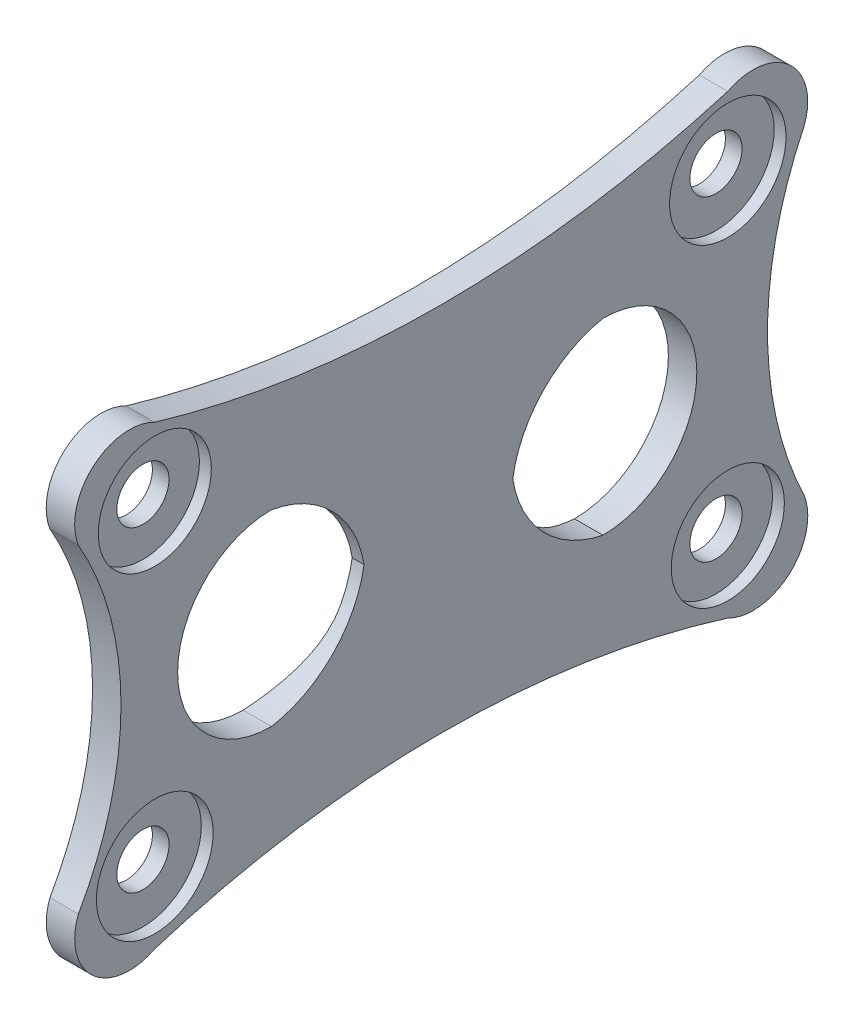
from build123d import *

# Parameters (mm, degrees)
SKETCH_1_W          = 87
SKETCH_1_H          = 63
SKETCH_1_W_2        = 83
SKETCH_1_H_2        = 59
EXTRUDE_1_DEPTH     = 5
SKETCH_2_W          = 87
SKETCH_2_H          = 63
EXTRUDE_2_DEPTH     = 3
SKETCH_3_W          = 2.764626384
SKETCH_3_H          = 4.6515936
CUT_EXTRUDE_1_DEPTH = 2
FILLET_1_R          = 2
SKETCH_5_R          = 2.75
CUT_EXTRUDE_2_DEPTH = 10
SKETCH_6_OUTSIDE_W  = 110.542
SKETCH_6_OUTSIDE_H  = 86.542
CUT_EXTRUDE_3_DEPTH = 10
SKETCH_7_W          = 10.763963746
SKETCH_7_H          = 73.165580881
CUT_EXTRUDE_4_DEPTH = 125
SKETCH_8_R          = 5.963187944
SKETCH_8_R_2        = 6.141451549
SKETCH_8_R_3        = 6.157472201
SKETCH_8_R_4        = 5.967235868
CUT_EXTRUDE_5_DEPTH = 1.25
SKETCH_9_W          = 15.387789175
SKETCH_9_H          = 31.944271198
EXTRUDE_4_DEPTH     = 1.25
FILLET_2_R          = 12


with BuildPart() as part:
    # 草图1 → 凸台-拉伸1 (new body)
    with BuildSketch(Plane(origin=(0, 0, 0), x_dir=(0, 0, -1), z_dir=(1, 0, 0))):
        with Locations((3.90387463, 17.013155975)):
            Rectangle(SKETCH_1_W, SKETCH_1_H)
        with Locations((3.90387463, 17.013155975)):
            Rectangle(SKETCH_1_W_2, SKETCH_1_H_2, mode=Mode.SUBTRACT)
    extrude(amount=EXTRUDE_1_DEPTH)

    # 草图2 → 凸台-拉伸2 (add)
    with BuildSketch(Plane(origin=(5, 0, 0), x_dir=(0, 0, -1), z_dir=(1, 0, 0))):
        with Locations((3.90387463, 17.013155975)):
            Rectangle(SKETCH_2_W, SKETCH_2_H)
    extrude(amount=EXTRUDE_2_DEPTH)

    # 草图3 → 切除-拉伸1 (cut)
    with BuildSketch(Plane(origin=(0, 0, -47.40387463), x_dir=(-1, 0, 0), z_dir=(0, 0, -1))):
        with Locations((-3.662779601, -6.806448474)):
            Rectangle(SKETCH_3_W, SKETCH_3_H)
    extrude(amount=-CUT_EXTRUDE_1_DEPTH, mode=Mode.SUBTRACT)

    # 圆角1
    fillet_1_edges = [part.edges().sort_by_distance(p)[0] for p in [
        (8, 17.013155975, 39.59612537),
        (8, -14.486844025, -3.90387463),
        (8, 17.013155975, -47.40387463),
        (8, 48.513155975, -3.90387463),
        (4, 48.513155975, 39.59612537),
        (4, 48.513155975, -47.40387463),
        (4, -14.486844025, -47.40387463),
        (4, -14.486844025, 39.59612537),
    ]]
    fillet(fillet_1_edges, radius=FILLET_1_R)

    # 草图5 → 切除-拉伸2 (cut)
    with BuildSketch(Plane.ZY.offset(-5)):
        with Locations((-34.13110136, 33.698944985)):
            Circle(SKETCH_5_R)
        with Locations((26.3233521, 33.698944985)):
            Circle(SKETCH_5_R)
        with Locations((-34.13110136, 0.327366965)):
            Circle(SKETCH_5_R)
        with Locations((26.3233521, 0.327366965)):
            Circle(SKETCH_5_R)
    extrude(amount=-CUT_EXTRUDE_2_DEPTH, mode=Mode.SUBTRACT)

    # 草图6 outside → 切除-拉伸3 (cut)
    # profile 1 of 2: a face of its own
    with BuildSketch(Plane.ZY.offset(-5)):
        with Locations((-3.904, 17.013)):
            Rectangle(SKETCH_6_OUTSIDE_W, SKETCH_6_OUTSIDE_H)
        with BuildLine():
            ThreePointArc((-42.174874453, 33.698944985), (-38.319014018, 16.849472493), (-42.174874453, 0))
            ThreePointArc((-42.174874453, 0), (-40.649791206, -6.390726624), (-34.13110136, -7.211670209))
            ThreePointArc((-34.13110136, -7.211670209), (-3.895194581, -2.599840712), (26.340712199, -7.211670209))
            ThreePointArc((26.340712199, -7.211670209), (32.84921876, -6.379368362), (34.384485291, 0))
            ThreePointArc((34.384485291, 0), (29.88694456, 16.849472493), (34.384485291, 33.698944985))
            ThreePointArc((34.384485291, 33.698944985), (32.858946784, 40.089163818), (26.340712199, 40.910615194))
            ThreePointArc((26.340712199, 40.910615194), (-3.895194581, 36.525010702), (-34.13110136, 40.910615194))
            ThreePointArc((-34.13110136, 40.910615194), (-40.634931957, 40.073097857), (-42.174874453, 33.698944985))
        make_face(mode=Mode.SUBTRACT)
    # profile 2 of 2: a face of its own
    with BuildSketch(Plane.ZY.offset(-5)):
        with BuildLine():
            Line((-20.956673586, 26.753574551), (14.00692679, 26.753574551))
            ThreePointArc((14.00692679, 26.753574551), (23.911028849, 16.849472493), (14.00692679, 6.945370434))
            Line((14.00692679, 6.945370434), (-20.956673586, 6.945370434))
            ThreePointArc((-20.956673586, 6.945370434), (-30.860775645, 16.849472493), (-20.956673586, 26.753574551))
        make_face()
    extrude(amount=-CUT_EXTRUDE_3_DEPTH, mode=Mode.SUBTRACT)


with BuildPart() as cut_extrude_3_piece_1:
    # of the separate pieces the step leaves, piece 1, a body of its own (cut_extrude_3_pieces)
    add(part.part.solids().sort_by_distance((5, 33.698944985, 34.384485291))[0])

    # 草图8 → 切除-拉伸5 (cut)
    with BuildSketch(Plane(origin=(8, 0, 0), x_dir=(0, 0, -1), z_dir=(1, 0, 0))):
        with Locations((-26.3233521, 33.698944985)):
            Circle(SKETCH_8_R)
        with Locations((34.13110136, 33.698944985)):
            Circle(SKETCH_8_R_2)
        with Locations((-26.3233521, 0.327366965)):
            Circle(SKETCH_8_R_3)
        with Locations((34.13110136, 0.327366965)):
            Circle(SKETCH_8_R_4)
    extrude(amount=-CUT_EXTRUDE_5_DEPTH, mode=Mode.SUBTRACT)

    # 草图9 → 凸台-拉伸4 (add)
    with BuildSketch(Plane(origin=(8, 0, 0), x_dir=(0, 0, -1), z_dir=(1, 0, 0))):
        with Locations((3.60318744, 17.051189704)):
            Rectangle(SKETCH_9_W, SKETCH_9_H)
    extrude(amount=-EXTRUDE_4_DEPTH)

    # 圆角2
    # the kernel refuses this fillet: 12 mm, written as the material it adds along each edge
    with BuildSketch(Plane(origin=(6.75, 26.753574551, 4.090707148), x_dir=(-1, 0, 0), z_dir=(0, 0, -1)), Plane(origin=(6.75, 6.945370434, -11.297082027), x_dir=(-1, 0, 0), z_dir=(0, 0, 1))) as fillet_2_piece_1:
        with BuildLine():
            CenterArc((12, -6.239991987), FILLET_2_R, 148.667793293, 31.332206707)
            Line((0, -6.239991987), (-0.24, -6.239991987))
            Line((-0.24, -6.239991987), (-0.24, 0))
            Line((-0.24, 0), (0, 0.24))
            ThreePointArc((0, 0.24), (0.875, 0.24), (1.545, 0.12479984))
            Line((1.545, 0.12479984), (1.75, 0))
        make_face()
    extrude(amount=15.387789175)
    with BuildSketch(Plane(origin=(6.75, 6.945370434, -11.297082027), x_dir=(0, 0, -1), z_dir=(1, 0, 0)), Plane(origin=(8, 26.753574551, -11.297082027), x_dir=(0, 0, -1), z_dir=(-1, 0, 0))) as fillet_2_piece_2:
        with BuildLine():
            CenterArc((12, 11.769557695), FILLET_2_R, 180, 78.753288074)
            Line((0, 11.769557695), (-0.24, 11.769557695))
            Line((-0.24, 11.769557695), (-0.24, 0))
            Line((-0.24, 0), (0, -0.24))
            ThreePointArc((0, -0.24), (4.82979578, -0.24), (9.612783391, -0.235391154))
            Line((9.612783391, -0.235391154), (9.65959156, 0))
        make_face()
    extrude(amount=1.25)
    with BuildSketch(Plane(origin=(8, 6.945370434, 4.090707148), x_dir=(0, 0, 1), z_dir=(-1, 0, 0)), Plane(origin=(6.75, 26.753574551, 4.090707148), x_dir=(0, 0, 1), z_dir=(1, 0, 0))) as fillet_2_piece_3:
        with BuildLine():
            CenterArc((12, 11.817692644), FILLET_2_R, 180, 79.999989207)
            Line((0, 11.817692644), (-0.24, 11.817692644))
            Line((-0.24, 11.817692644), (-0.24, 0))
            Line((-0.24, 0), (0, -0.24))
            ThreePointArc((0, -0.24), (4.958109821, -0.24), (9.874544035, -0.236353853))
            Line((9.874544035, -0.236353853), (9.916219642, 0))
        make_face()
    extrude(amount=1.25)
    with BuildSketch(Plane(origin=(-22.794231609, 26.753574551, 4.090707148), x_dir=(0, 0, 1), z_dir=(1, 0, 0))) as fillet_2_piece_4a_section:
        with BuildLine():
            CenterArc((12, 11.817692644), FILLET_2_R, 180, 79.999989207)
            Line((0, 11.817692644), (-0.24, 11.817692644))
            Line((-0.24, 11.817692644), (-0.24, 0))
            Line((-0.24, 0), (0, -0.24))
            ThreePointArc((0, -0.24), (4.958109821, -0.24), (9.874544035, -0.236353853))
            Line((9.874544035, -0.236353853), (9.916219642, 0))
        make_face()
    fillet_2_piece_4a = extrude(amount=30.794231609, mode=Mode.PRIVATE)
    fillet_2_piece_4a = split(fillet_2_piece_4a, bisect_by=Plane(origin=(5, 26.753574551, 4.090707148), z_dir=(1, 0, 0)), keep=Keep.TOP, mode=Mode.PRIVATE)
    fillet_2_piece_4a = split(fillet_2_piece_4a, bisect_by=Plane(origin=(6.75, 26.753574551, 4.090707148), z_dir=(-1, 0, 0)), keep=Keep.TOP, mode=Mode.PRIVATE)
    with BuildSketch(Plane(origin=(6.75, 26.753574551, 19.690687116), x_dir=(-1, 0, 0), z_dir=(0, 0, -1))) as fillet_2_piece_4b_section:
        with BuildLine():
            CenterArc((12, -6.239991987), FILLET_2_R, 148.667793293, 31.332206707)
            Line((0, -6.239991987), (-0.24, -6.239991987))
            Line((-0.24, -6.239991987), (-0.24, 0))
            Line((-0.24, 0), (0, 0.24))
            ThreePointArc((0, 0.24), (0.875, 0.24), (1.545, 0.12479984))
            Line((1.545, 0.12479984), (1.75, 0))
        make_face()
    fillet_2_piece_4b = extrude(amount=30.987769142, mode=Mode.PRIVATE)
    fillet_2_piece_4b = split(fillet_2_piece_4b, bisect_by=Plane(origin=(6.75, 26.753574551, 4.090707148), z_dir=(0, 0, 1)), keep=Keep.TOP, mode=Mode.PRIVATE)
    fillet_2_piece_4 = fillet_2_piece_4a & fillet_2_piece_4b
    add(fillet_2_piece_4)
    with BuildSketch(Plane(origin=(6.75, 26.753574551, 4.090707148), x_dir=(-1, 0, 0), z_dir=(0, 0, -1))) as fillet_2_piece_5a_section:
        with BuildLine():
            CenterArc((12, -6.239991987), FILLET_2_R, 148.667793293, 31.332206707)
            Line((0, -6.239991987), (-0.24, -6.239991987))
            Line((-0.24, -6.239991987), (-0.24, 0))
            Line((-0.24, 0), (0, 0.24))
            ThreePointArc((0, 0.24), (0.875, 0.24), (1.545, 0.12479984))
            Line((1.545, 0.12479984), (1.75, 0))
        make_face()
    fillet_2_piece_5a = extrude(amount=30.987769142, mode=Mode.PRIVATE)
    fillet_2_piece_5a = split(fillet_2_piece_5a, bisect_by=Plane(origin=(6.75, 26.753574551, -11.297082027), z_dir=(0, 0, -1)), keep=Keep.TOP, mode=Mode.PRIVATE)
    with BuildSketch(Plane(origin=(8, 26.753574551, -11.297082027), x_dir=(0, 0, -1), z_dir=(-1, 0, 0))) as fillet_2_piece_5b_section:
        with BuildLine():
            CenterArc((12, 11.769557695), FILLET_2_R, 180, 78.753288074)
            Line((0, 11.769557695), (-0.24, 11.769557695))
            Line((-0.24, 11.769557695), (-0.24, 0))
            Line((-0.24, 0), (0, -0.24))
            ThreePointArc((0, -0.24), (4.82979578, -0.24), (9.612783391, -0.235391154))
            Line((9.612783391, -0.235391154), (9.65959156, 0))
        make_face()
    fillet_2_piece_5b = extrude(amount=30.673894237, mode=Mode.PRIVATE)
    fillet_2_piece_5b = split(fillet_2_piece_5b, bisect_by=Plane(origin=(5, 26.753574551, -11.297082027), z_dir=(1, 0, 0)), keep=Keep.TOP, mode=Mode.PRIVATE)
    fillet_2_piece_5b = split(fillet_2_piece_5b, bisect_by=Plane(origin=(6.75, 26.753574551, -11.297082027), z_dir=(-1, 0, 0)), keep=Keep.TOP, mode=Mode.PRIVATE)
    fillet_2_piece_5 = fillet_2_piece_5a & fillet_2_piece_5b
    add(fillet_2_piece_5)
    with BuildSketch(Plane(origin=(-22.673894237, 6.945370434, -11.297082027), x_dir=(0, 0, -1), z_dir=(1, 0, 0))) as fillet_2_piece_6a_section:
        with BuildLine():
            CenterArc((12, 11.769557695), FILLET_2_R, 180, 78.753288074)
            Line((0, 11.769557695), (-0.24, 11.769557695))
            Line((-0.24, 11.769557695), (-0.24, 0))
            Line((-0.24, 0), (0, -0.24))
            ThreePointArc((0, -0.24), (4.82979578, -0.24), (9.612783391, -0.235391154))
            Line((9.612783391, -0.235391154), (9.65959156, 0))
        make_face()
    fillet_2_piece_6a = extrude(amount=30.673894237, mode=Mode.PRIVATE)
    fillet_2_piece_6a = split(fillet_2_piece_6a, bisect_by=Plane(origin=(5, 6.945370434, -11.297082027), z_dir=(1, 0, 0)), keep=Keep.TOP, mode=Mode.PRIVATE)
    fillet_2_piece_6a = split(fillet_2_piece_6a, bisect_by=Plane(origin=(6.75, 6.945370434, -11.297082027), z_dir=(-1, 0, 0)), keep=Keep.TOP, mode=Mode.PRIVATE)
    with BuildSketch(Plane(origin=(6.75, 6.945370434, -26.897061994), x_dir=(-1, 0, 0), z_dir=(0, 0, 1))) as fillet_2_piece_6b_section:
        with BuildLine():
            CenterArc((12, -6.239991987), FILLET_2_R, 148.667793293, 31.332206707)
            Line((0, -6.239991987), (-0.24, -6.239991987))
            Line((-0.24, -6.239991987), (-0.24, 0))
            Line((-0.24, 0), (0, 0.24))
            ThreePointArc((0, 0.24), (0.875, 0.24), (1.545, 0.12479984))
            Line((1.545, 0.12479984), (1.75, 0))
        make_face()
    fillet_2_piece_6b = extrude(amount=30.987769142, mode=Mode.PRIVATE)
    fillet_2_piece_6b = split(fillet_2_piece_6b, bisect_by=Plane(origin=(6.75, 6.945370434, -11.297082027), z_dir=(0, 0, -1)), keep=Keep.TOP, mode=Mode.PRIVATE)
    fillet_2_piece_6 = fillet_2_piece_6a & fillet_2_piece_6b
    add(fillet_2_piece_6)
    with BuildSketch(Plane(origin=(6.75, 6.945370434, -11.297082027), x_dir=(-1, 0, 0), z_dir=(0, 0, 1))) as fillet_2_piece_7a_section:
        with BuildLine():
            CenterArc((12, -6.239991987), FILLET_2_R, 148.667793293, 31.332206707)
            Line((0, -6.239991987), (-0.24, -6.239991987))
            Line((-0.24, -6.239991987), (-0.24, 0))
            Line((-0.24, 0), (0, 0.24))
            ThreePointArc((0, 0.24), (0.875, 0.24), (1.545, 0.12479984))
            Line((1.545, 0.12479984), (1.75, 0))
        make_face()
    fillet_2_piece_7a = extrude(amount=30.987769142, mode=Mode.PRIVATE)
    fillet_2_piece_7a = split(fillet_2_piece_7a, bisect_by=Plane(origin=(6.75, 6.945370434, 4.090707148), z_dir=(0, 0, 1)), keep=Keep.TOP, mode=Mode.PRIVATE)
    with BuildSketch(Plane(origin=(8, 6.945370434, 4.090707148), x_dir=(0, 0, 1), z_dir=(-1, 0, 0))) as fillet_2_piece_7b_section:
        with BuildLine():
            CenterArc((12, 11.817692644), FILLET_2_R, 180, 79.999989207)
            Line((0, 11.817692644), (-0.24, 11.817692644))
            Line((-0.24, 11.817692644), (-0.24, 0))
            Line((-0.24, 0), (0, -0.24))
            ThreePointArc((0, -0.24), (4.958109821, -0.24), (9.874544035, -0.236353853))
            Line((9.874544035, -0.236353853), (9.916219642, 0))
        make_face()
    fillet_2_piece_7b = extrude(amount=30.794231609, mode=Mode.PRIVATE)
    fillet_2_piece_7b = split(fillet_2_piece_7b, bisect_by=Plane(origin=(5, 6.945370434, 4.090707148), z_dir=(1, 0, 0)), keep=Keep.TOP, mode=Mode.PRIVATE)
    fillet_2_piece_7b = split(fillet_2_piece_7b, bisect_by=Plane(origin=(6.75, 6.945370434, 4.090707148), z_dir=(-1, 0, 0)), keep=Keep.TOP, mode=Mode.PRIVATE)
    fillet_2_piece_7 = fillet_2_piece_7a & fillet_2_piece_7b
    add(fillet_2_piece_7)


with BuildPart() as cut_extrude_3_piece_2:
    # of the separate pieces the step leaves, piece 2, a body of its own (cut_extrude_3_pieces)
    add(part.part.solids().sort_by_distance((0, 48.513155975, 37.59612537))[0])

    # 草图7 → 切除-拉伸4 (cut)
    with BuildSketch(Plane(origin=(0, 0, -47.40387463), x_dir=(-1, 0, 0), z_dir=(0, 0, -1))):
        with Locations((0.381981873, 14.788439085)):
            Rectangle(SKETCH_7_W, SKETCH_7_H)
    extrude(amount=-CUT_EXTRUDE_4_DEPTH, mode=Mode.SUBTRACT)


solid = cut_extrude_3_piece_1.part
